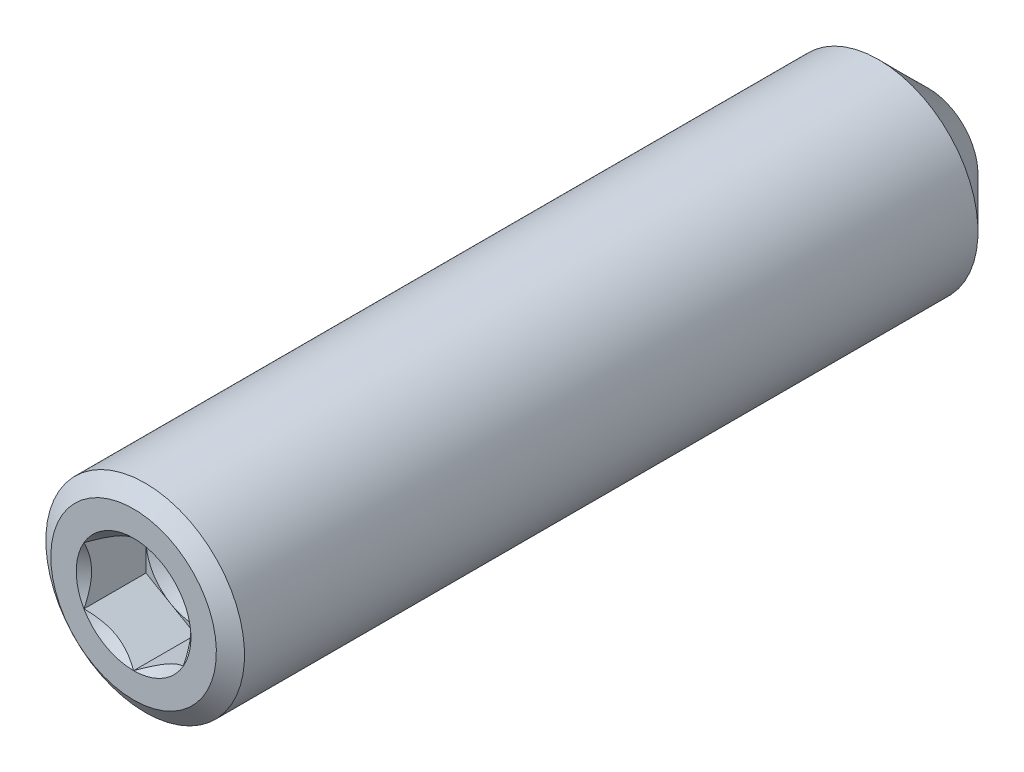
from build123d import *

# Parameters (mm, degrees)
CUT_EXTRUDE1_DEPTH = 0.9375


with BuildPart() as part:
    # Sketch11 → Revolve1 (revolve)
    with BuildSketch(Plane(origin=(0, 0, 0), x_dir=(0, 0, -1), z_dir=(1, 0, 0))):
        Polygon((-6, 0), (-6, 1.25), (-5.824948115, 1.5), (5.25, 1.5), (6, 0.75), (5.549354536, 0), align=None)
    revolve(axis=Axis((0, 0, -5.549354536), (0, 0, -1)))

    # Sketch2 → Cut-Extrude1 (cut)
    with BuildSketch(Plane.XY.offset(6)):
        Polygon((0, 0.866025404), (-0.75, 0.433012702), (-0.75, -0.433012702), (0, -0.866025404), (0.75, -0.433012702), (0.75, 0.433012702), align=None)
    extrude(amount=-CUT_EXTRUDE1_DEPTH, mode=Mode.SUBTRACT)

    # Cut-Extrude2 cone 1 section (through the dimple's axis) → Cut-Extrude2 (revolve, cut)
    with BuildSketch(Plane(origin=(0, 0, 6), x_dir=(0, -1, 0), z_dir=(1, 0, 0))):
        Polygon((0, 0), (0.866025404, 0), (0, 0.866025404), align=None)
    revolve(axis=Axis((0, 0, 6), (0, 0, -1)), mode=Mode.SUBTRACT)

    # Cut-Extrude3 cone 1 section (through the dimple's axis) → Cut-Extrude3 (revolve, cut)
    with BuildSketch(Plane(origin=(0, 0, 5.0625), x_dir=(0, -1, 0), z_dir=(1, 0, 0))):
        Polygon((0, 0), (0.75, 0), (0, 0.433012702), align=None)
    revolve(axis=Axis((0, 0, 5.0625), (0, 0, -1)), mode=Mode.SUBTRACT)


solid = part.part
